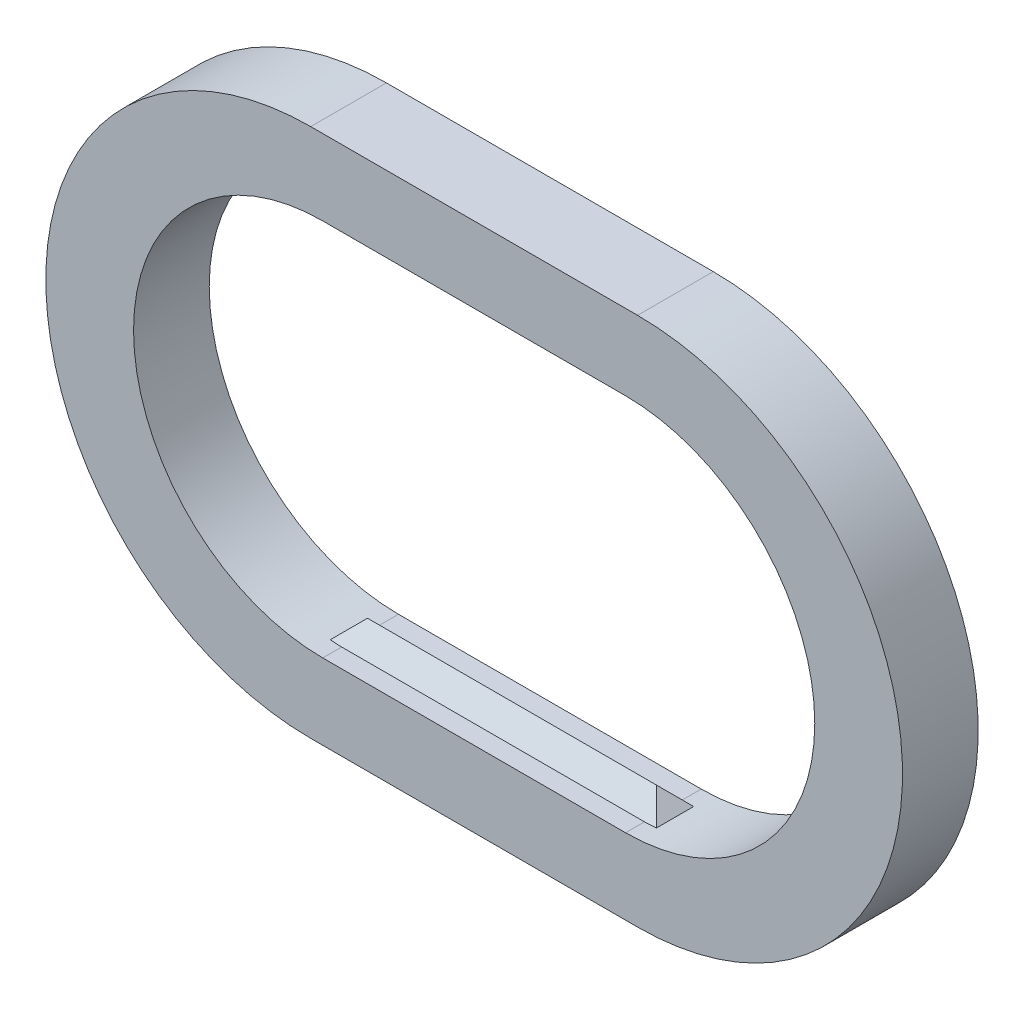
from build123d import *

# Parameters (mm, degrees)
BASEBOSS_EXTRUDE1_DEPTH = 2
SKETCH3_W               = 8.636942675
SKETCH3_H               = 1
BOSS_EXTRUDE1_DEPTH     = 0.5
SKETCH4_W               = 8.636942675
SKETCH4_H               = 1
BOSS_EXTRUDE2_DEPTH     = 0.5
CHAMFER1_SIZE           = 0.5
CHAMFER2_SIZE           = 0.5


# Some blends are built 0.0001 mm under size
with BuildPart() as part:
    # Sketch1 → BaseBoss-Extrude1 (new body)
    with BuildSketch(Plane.XY):
        with BuildLine():
            Line((19.925716198, 10.915607247), (28.562658873, 10.915607247))
            ThreePointArc((28.562658873, 10.915607247), (35.562658873, 3.915607247), (28.562658873, -3.084392753))
            Line((28.562658873, -3.084392753), (19.925716198, -3.084392753))
            ThreePointArc((19.925716198, -3.084392753), (12.925716198, 3.915607247), (19.925716198, 10.915607247))
        make_face()
        with BuildLine():
            Line((20.244187536, 8.915607247), (28.244187536, 8.915607247))
            ThreePointArc((28.244187536, 8.915607247), (33.244187536, 3.915607247), (28.244187536, -1.084392753))
            Line((28.244187536, -1.084392753), (20.244187536, -1.084392753))
            ThreePointArc((20.244187536, -1.084392753), (15.244187536, 3.915607247), (20.244187536, 8.915607247))
        make_face(mode=Mode.SUBTRACT)
    extrude(amount=BASEBOSS_EXTRUDE1_DEPTH)

    # Sketch3 → Boss-Extrude1 (add)
    with BuildSketch(Plane.XZ.offset(-8.915607247)):
        with Locations((24.244187536, 0.9)):
            Rectangle(SKETCH3_W, SKETCH3_H)
    extrude(amount=BOSS_EXTRUDE1_DEPTH)

    # Sketch4 → Boss-Extrude2 (add)
    with BuildSketch(Plane(origin=(0, -1.084392753, 0), x_dir=(1, 0, 0), z_dir=(0, 1, 0))):
        with Locations((24.244187536, -1)):
            Rectangle(SKETCH4_W, SKETCH4_H)
    extrude(amount=BOSS_EXTRUDE2_DEPTH)

    # Chamfer1
    # the kernel refuses this chamfer: 0.5 mm, written as the material it takes off along each edge
    with BuildSketch(Plane(origin=(28.562658873, -0.584392753, -0.785841494), x_dir=(0.02749587661058907, -0.9996219169112965, 0), z_dir=(0, 0, 1))) as chamfer1_piece_1_section:
        Polygon((CHAMFER1_SIZE * 0.999621916911, -CHAMFER1_SIZE * 0.0274958766106), (-CHAMFER1_SIZE * 0.0274958766106, -CHAMFER1_SIZE * 0.999621916911), (0, 0), align=None)
    chamfer1_piece_1 = extrude(amount=3.571682988, mode=Mode.PRIVATE)
    chamfer1_piece_1 = chamfer1_piece_1 & Plane(origin=(28.244187536, 3.915607247, 1), x_dir=(0, 1, 0), z_dir=(0, 0, -1)) * Cylinder(5, 10, mode=Mode.PRIVATE)
    add(chamfer1_piece_1, mode=Mode.SUBTRACT)
    with BuildSketch(Plane(origin=(19.925716198, -0.584392753, 2.785841494), x_dir=(-0.02749587661058907, -0.9996219169112965, 0), z_dir=(0, 0, -1))) as chamfer1_piece_2_section:
        Polygon((CHAMFER1_SIZE * 0.999621916911, -CHAMFER1_SIZE * 0.0274958766106), (-CHAMFER1_SIZE * 0.0274958766106, -CHAMFER1_SIZE * 0.999621916911), (0, 0), align=None)
    chamfer1_piece_2 = extrude(amount=3.571682988, mode=Mode.PRIVATE)
    chamfer1_piece_2 = chamfer1_piece_2 & Plane(origin=(20.244187536, 3.915607247, 1), x_dir=(0, -1, 0), z_dir=(0, 0, -1)) * Cylinder(5, 10, mode=Mode.PRIVATE)
    add(chamfer1_piece_2, mode=Mode.SUBTRACT)
    with BuildSketch(Plane(origin=(28.562658873, 8.415607247, 2.685841494), x_dir=(0.0274958766105891, 0.9996219169112968, 0), z_dir=(0, 0, -1))) as chamfer1_piece_3_section:
        Polygon((CHAMFER1_SIZE * 0.999621916911, -CHAMFER1_SIZE * 0.0274958766106), (-CHAMFER1_SIZE * 0.0274958766106, -CHAMFER1_SIZE * 0.999621916911), (0, 0), align=None)
    chamfer1_piece_3 = extrude(amount=3.571682988, mode=Mode.PRIVATE)
    chamfer1_piece_3 = chamfer1_piece_3 & Plane(origin=(28.244187536, 3.915607247, 0.9), x_dir=(0, 1, 0), z_dir=(0, 0, -1)) * Cylinder(5, 10, mode=Mode.PRIVATE)
    add(chamfer1_piece_3, mode=Mode.SUBTRACT)
    with BuildSketch(Plane(origin=(19.925716198, 8.415607247, -0.885841494), x_dir=(-0.0274958766105891, 0.9996219169112968, 0), z_dir=(0, 0, 1))) as chamfer1_piece_4_section:
        Polygon((CHAMFER1_SIZE * 0.999621916911, -CHAMFER1_SIZE * 0.0274958766106), (-CHAMFER1_SIZE * 0.0274958766106, -CHAMFER1_SIZE * 0.999621916911), (0, 0), align=None)
    chamfer1_piece_4 = extrude(amount=3.571682988, mode=Mode.PRIVATE)
    chamfer1_piece_4 = chamfer1_piece_4 & Plane(origin=(20.244187536, 3.915607247, 0.9), x_dir=(0, -1, 0), z_dir=(0, 0, -1)) * Cylinder(5, 10, mode=Mode.PRIVATE)
    add(chamfer1_piece_4, mode=Mode.SUBTRACT)

    # Chamfer2
    chamfer2_edges = [part.edges().sort_by_distance(p)[0] for p in [
        (24.244187536, -0.584392753, 0.5),
        (24.244187536, 8.415607247, 0.4),
        (24.244187536, 8.415607247, 1.4),
        (24.244187536, -0.584392753, 1.5),
    ]]
    chamfer(chamfer2_edges, length=CHAMFER2_SIZE - 0.0001)  # a hair under: the kernel refuses the full size


solid = part.part
